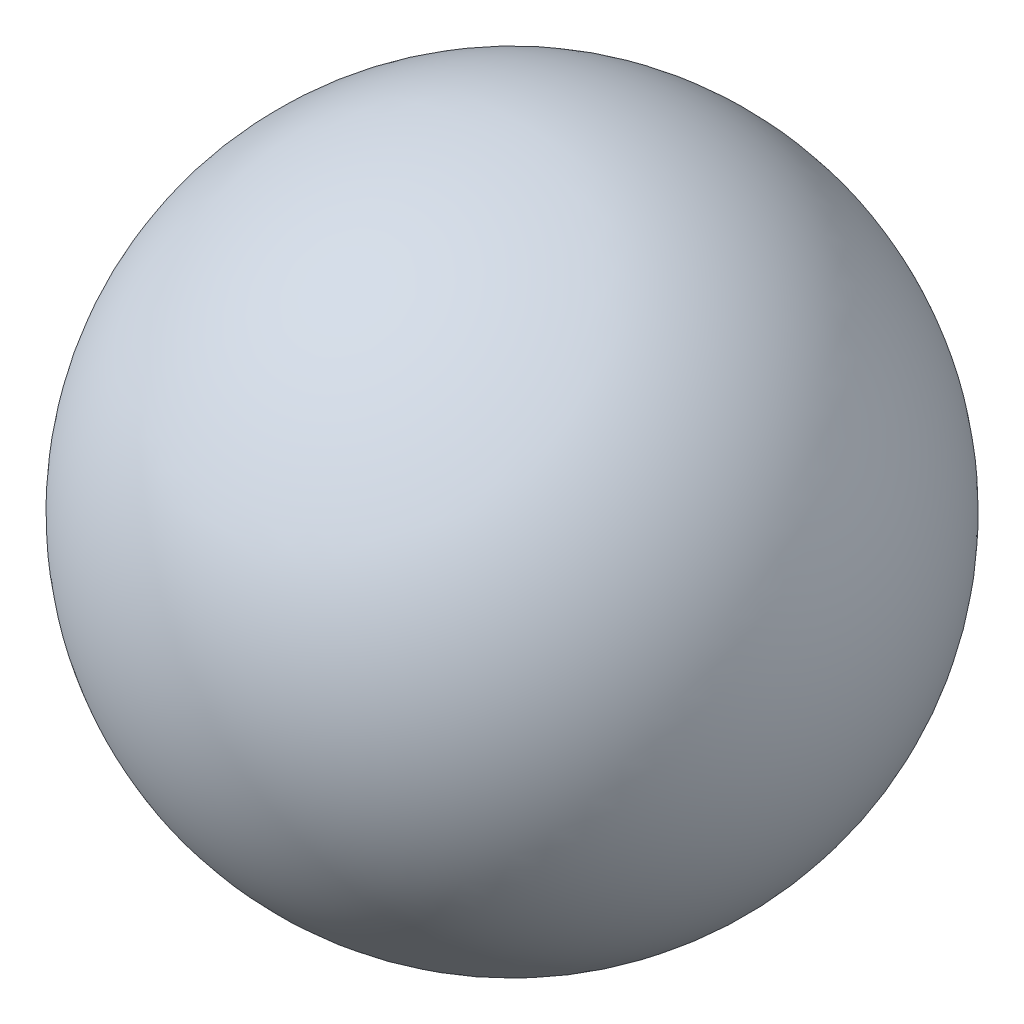
from build123d import *


with BuildPart() as part:
    # Sketch1 → Revolve3 (revolve)
    with BuildSketch(Plane(origin=(0, 0, 0), x_dir=(1, 0, 0), z_dir=(0, 1, 0))):
        with BuildLine():
            ThreePointArc((0, 88.9), (-88.9, 0), (0, -88.9))
            Line((0, -88.9), (0, 88.9))
        make_face()
    revolve(axis=Axis((0, 0, 1000), (0, 0, -1)))


solid = part.part
